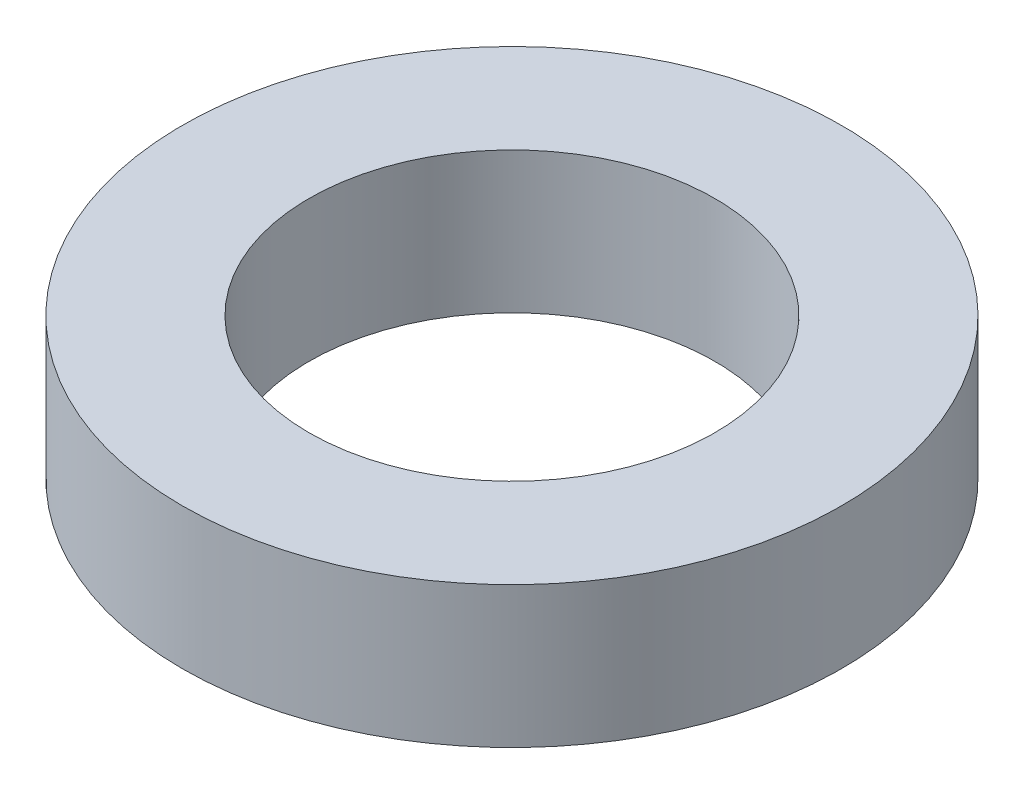
from build123d import *

# Parameters (mm, degrees)
SKETCH1_R             = 23.7
SKETCH1_R_2           = 18.7
BOSS_EXTRUDE1_DEPTH   = 10
SKETCH1_R_3           = 30.369411186
SKETCH1_R_4           = 25.25
BOSS_EXTRUDE1_2_DEPTH = 10
BOSS_EXTRUDE2_START   = 3
SKETCH2_R             = 30.369411186
SKETCH2_R_2           = 18.7
BOSS_EXTRUDE2_DEPTH   = 3


with BuildPart() as part:
    # Sketch1 → Boss-Extrude1 (new body)
    with BuildSketch(Plane(origin=(0, 0, 0), x_dir=(1, 0, 0), z_dir=(0, 1, 0))):
        Circle(SKETCH1_R)
        Circle(SKETCH1_R_2, mode=Mode.SUBTRACT)
    extrude(amount=-BOSS_EXTRUDE1_DEPTH)



with BuildPart() as body_2:
    # Sketch1 → Boss-Extrude1 2 (new body)
    with BuildSketch(Plane(origin=(0, 0, 0), x_dir=(1, 0, 0), z_dir=(0, 1, 0))):
        Circle(SKETCH1_R_3)
        Circle(SKETCH1_R_4, mode=Mode.SUBTRACT)
    extrude(amount=-BOSS_EXTRUDE1_2_DEPTH)


with BuildPart() as part_1:
    add(part.part)

    add(body_2.part)  # Boss-Extrude2 merges body 2
    # Sketch2 → Boss-Extrude2 (add)
    with BuildSketch(Plane(origin=(0, 0, 0), x_dir=(1, 0, 0), z_dir=(0, 1, 0)).offset(BOSS_EXTRUDE2_START)):
        Circle(SKETCH2_R)
        Circle(SKETCH2_R_2, mode=Mode.SUBTRACT)
    extrude(amount=-BOSS_EXTRUDE2_DEPTH)


solid = part_1.part
